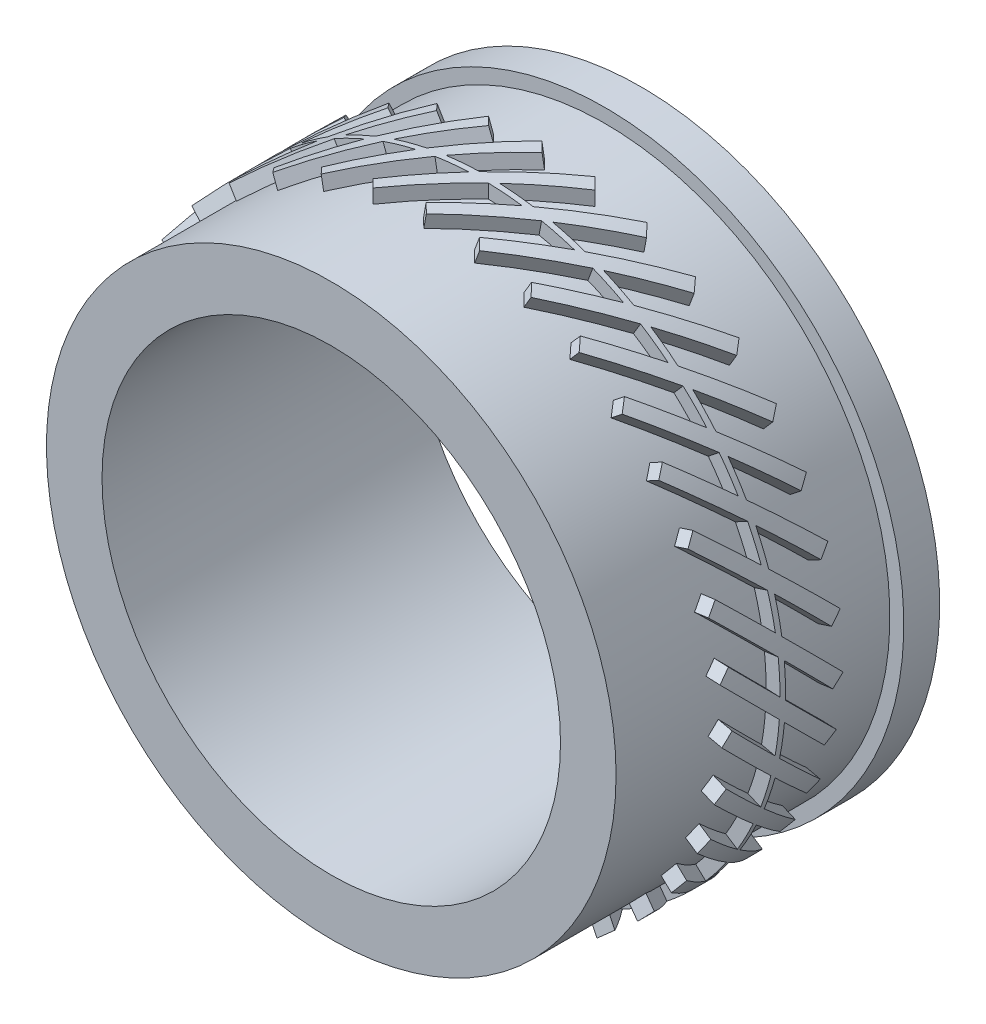
from build123d import *
from build123d.topology import SkipClean

# Parameters (mm, degrees)
SKETCH1_R                = 13.0175
SKETCH1_R_2              = 10.4775
BOSS_EXTRUDE1_DEPTH      = 6.985
SKETCH1_4_R              = 13.6525
SKETCH1_4_R_2            = 13.0175
BOSS_EXTRUDE2_DEPTH      = 0.127
BOSS_EXTRUDE3_REACH      = 22.532
BOSS_EXTRUDE3_END_RADIUS = 13.6525
CIRPATTERN1_COUNT        = 35
SKETCH1_5_R              = 10.4775
CUT_EXTRUDE2_DEPTH       = 6.985
SKETCH6_R                = 13.6525
SKETCH6_R_2              = 10.4775
BOSS_EXTRUDE6_DEPTH      = 0.82042
CUT_EXTRUDE3_DEPTH       = 21.596029605


with BuildPart() as part:
    # Sketch1 → Boss-Extrude1 (new, symmetric)
    with BuildSketch(Plane.XY):
        Circle(SKETCH1_R)
        Circle(SKETCH1_R_2, mode=Mode.SUBTRACT)
    extrude(amount=BOSS_EXTRUDE1_DEPTH, both=True)

    # Sketch1<4> → Boss-Extrude2 (add, symmetric)
    with BuildSketch(Plane.XY):
        Circle(SKETCH1_4_R)
        Circle(SKETCH1_4_R_2, mode=Mode.SUBTRACT)
    extrude(amount=BOSS_EXTRUDE2_DEPTH, both=True)

    # Boss-Extrude3: up to this cylinder (the profile starts inside it)
    with SkipClean():  # the faces are left unmerged after this step: merging them gives an invalid solid
        boss_extrude3_end = Plane(origin=(0, 0, 0), z_dir=(0, 0, -1)) * Cylinder(BOSS_EXTRUDE3_END_RADIUS, 73.369, mode=Mode.PRIVATE)
        # Sketch4 → Boss-Extrude3 (add, up to the surface)
        with BuildSketch(Plane(origin=(0, 0, 0), x_dir=(1, 0, 0), z_dir=(0, 1, 0)), mode=Mode.PRIVATE) as boss_extrude3_sk1:
            Polygon((2.764506403, 2.315493597), (-2.315493597, -2.764506403), (-2.764506403, -2.315493597), (2.315493597, 2.764506403), align=None)
        boss_extrude3_tool1 = extrude(boss_extrude3_sk1.sketch, amount=BOSS_EXTRUDE3_REACH, mode=Mode.PRIVATE) & boss_extrude3_end
        boss_extrude3 = boss_extrude3_tool1.solids().sort_by_distance((0, 0, 0))[0]
        add(boss_extrude3)

    # CirPattern1: Boss-Extrude3 ×35 about axis
    with SkipClean():  # the faces are left unmerged after this step: merging them gives an invalid solid
        cirpattern1_axis = Axis((0, 0, 0), (0, 0, 1))
        for i in range(1, CIRPATTERN1_COUNT):
            add(boss_extrude3.rotate(cirpattern1_axis, i * 360 / CIRPATTERN1_COUNT))

    # Sketch1<5> → Cut-Extrude2 (cut, symmetric)
    with SkipClean():  # the faces are left unmerged after this step: merging them gives an invalid solid
        with BuildSketch(Plane.XY):
            Circle(SKETCH1_5_R)
        extrude(amount=CUT_EXTRUDE2_DEPTH, both=True, mode=Mode.SUBTRACT)

    # Sketch6 → Boss-Extrude6 (add, symmetric)
    with BuildSketch(Plane(origin=(0, 0, -6.35), x_dir=(-1, 0, 0), z_dir=(0, 0, -1))):
        Circle(SKETCH6_R)
        Circle(SKETCH6_R_2, mode=Mode.SUBTRACT)
    extrude(amount=BOSS_EXTRUDE6_DEPTH, both=True)

    # Sketch4<19> → Cut-Extrude3 (cut, through all)
    # profile 1 of 10: a face of its own
    with BuildSketch(Plane(origin=(0, 0, 0), x_dir=(1, 0, 0), z_dir=(0, 1, 0))):
        with BuildLine():
            ThreePointArc((1.566348758, 5.867669953), (1.307747925, 5.746622786), (1.031626766, 5.819313315))
            ThreePointArc((1.031626766, 5.819313315), (0.842237613, 6.319789927), (0.428531892, 6.659190378))
            Line((0.428531892, 6.659190378), (0.60167716, 6.832335646))
            ThreePointArc((0.60167716, 6.832335646), (0.860412343, 6.953395929), (1.136621561, 6.880540213))
            ThreePointArc((1.136621561, 6.880540213), (1.325905989, 6.380164404), (1.739426226, 6.040744959))
            Line((1.739426226, 6.040744959), (1.566348758, 5.867669953))
        make_face()
        with BuildLine():
            ThreePointArc((1.018821456, 6.801939772), (0.84586666, 6.823392576), (0.691479721, 6.742533085))
            Line((0.691479721, 6.742533085), (0.637630649, 6.688684012))
            ThreePointArc((0.637630649, 6.688684012), (0.977082629, 6.347410418), (1.14941525, 5.897969899))
            ThreePointArc((1.14941525, 5.897969899), (1.322271948, 5.876634887), (1.476543603, 5.957473474))
            Line((1.476543603, 5.957473474), (1.530363313, 6.01129321))
            ThreePointArc((1.530363313, 6.01129321), (1.191058115, 6.352570503), (1.018821456, 6.801939772))
        make_face(mode=Mode.SUBTRACT)
    # profile 2 of 10: a face of its own
    with BuildSketch(Plane(origin=(0, 0, 0), x_dir=(1, 0, 0), z_dir=(0, 1, 0))):
        with BuildLine():
            ThreePointArc((-0.659529785, 6.880619266), (-0.470152803, 6.380219564), (-0.056521805, 6.040848232))
            Line((-0.056521805, 6.040848232), (-0.229702104, 5.867669721))
            ThreePointArc((-0.229702104, 5.867669721), (-0.488305497, 5.746622514), (-0.764428217, 5.81931629))
            ThreePointArc((-0.764428217, 5.81931629), (-0.953816926, 6.319791567), (-1.367522133, 6.65919043))
            Line((-1.367522133, 6.65919043), (-1.19436846, 6.832343781))
            ThreePointArc((-1.19436846, 6.832343781), (-0.935696894, 6.953397105), (-0.659529785, 6.880619266))
        make_face()
        with BuildLine():
            ThreePointArc((-0.777441459, 6.802044546), (-0.950296312, 6.823378291), (-1.104566306, 6.742540813))
            Line((-1.104566306, 6.742540813), (-1.158414584, 6.688692635))
            ThreePointArc((-1.158414584, 6.688692635), (-0.818961848, 6.347414916), (-0.646631592, 5.897969788))
            ThreePointArc((-0.646631592, 5.897969788), (-0.473775742, 5.876634801), (-0.319504532, 5.957472416))
            Line((-0.319504532, 5.957472416), (-0.265654159, 6.011322232))
            ThreePointArc((-0.265654159, 6.011322232), (-0.605109158, 6.352599121), (-0.777441459, 6.802044546))
        make_face(mode=Mode.SUBTRACT)
    # profile 3 of 10: a face of its own
    with BuildSketch(Plane(origin=(0, 0, 0), x_dir=(1, 0, 0), z_dir=(0, 1, 0))):
        with BuildLine():
            Line((2.168253354, 6.858), (2.168253354, 6.984800972))
            Line((2.168253354, 6.984800972), (1.335231675, 6.984800972))
            ThreePointArc((1.335231675, 6.984800972), (1.344565242, 6.96058185), (1.348780062, 6.934970981))
            ThreePointArc((1.348780062, 6.934970981), (1.352041065, 6.896387153), (1.357117719, 6.858))
            Line((1.357117719, 6.858), (2.168253354, 6.858))
        make_face()
    # profile 4 of 10: a face of its own
    with BuildSketch(Plane(origin=(0, 0, 0), x_dir=(1, 0, 0), z_dir=(0, 1, 0))):
        Polygon((1.719012553, 5.715005039), (2.168253354, 5.715005039), (2.168253354, 5.842004699), (1.846014018, 5.842004699), align=None)
    # profile 5 of 10: a face of its own
    with BuildSketch(Plane(origin=(0, 0, 0), x_dir=(1, 0, 0), z_dir=(0, 1, 0))):
        Polygon((-1.796048961, 6.984998329), (-1.796048961, 6.858001223), (-1.474039962, 6.858001223), (-1.347032123, 6.985008827), align=None)
    # profile 6 of 10: a face of its own
    with BuildSketch(Plane(origin=(0, 0, 0), x_dir=(1, 0, 0), z_dir=(0, 1, 0))):
        with BuildLine():
            Line((-0.984950522, 5.84200524), (-1.796048961, 5.84200524))
            Line((-1.796048961, 5.84200524), (-1.796049299, 5.715004259))
            Line((-1.796049299, 5.715004259), (-0.963024847, 5.715004259))
            ThreePointArc((-0.963024847, 5.715004259), (-0.972364886, 5.73923109), (-0.976582544, 5.76485114))
            ThreePointArc((-0.976582544, 5.76485114), (-0.979854361, 5.803527122), (-0.984950522, 5.84200524))
        make_face()
    # profile 7 of 10: a face of its own
    with BuildSketch(Plane(origin=(0, 0, 0), x_dir=(1, 0, 0), z_dir=(0, 1, 0))):
        with BuildLine():
            Line((0.78408235, 7.031043689), (0.449012806, 6.985))
            Line((0.449012806, 6.985), (0, 6.535987194))
            ThreePointArc((0, 6.535987194), (0.562628379, 6.312887348), (0.819472926, 5.764840714))
            ThreePointArc((0.819472926, 5.764840714), (0.823685671, 5.739226374), (0.833021198, 5.715004699))
            Line((0.833021198, 5.715004699), (1.120199853, 5.678607514))
            ThreePointArc((1.120199853, 5.678607514), (1.028604553, 5.717036802), (0.946238388, 5.772555482))
            ThreePointArc((0.946238388, 5.772555482), (0.741581547, 6.305539185), (0.267949024, 6.624331095))
            Line((0.267949024, 6.624331095), (0.538815367, 6.895197439))
            ThreePointArc((0.538815367, 6.895197439), (0.651891276, 6.980376538), (0.78408235, 7.031043689))
        make_face()
    # profile 8 of 10: a face of its own
    with BuildSketch(Plane(origin=(0, 0, 0), x_dir=(1, 0, 0), z_dir=(0, 1, 0))):
        with BuildLine():
            Line((-1.474039962, 6.858001223), (-1.796056114, 6.535985668))
            ThreePointArc((-1.796056114, 6.535985668), (-1.262317389, 6.338815707), (-0.984950522, 5.84200524))
            ThreePointArc((-0.984950522, 5.84200524), (-0.979854361, 5.803527122), (-0.976582544, 5.76485114))
            ThreePointArc((-0.976582544, 5.76485114), (-0.972364886, 5.73923109), (-0.963024847, 5.715004259))
            Line((-0.963024847, 5.715004259), (-0.675845492, 5.678606986))
            ThreePointArc((-0.675845492, 5.678606986), (-0.767442233, 5.717036633), (-0.849809584, 5.772556183))
            ThreePointArc((-0.849809584, 5.772556183), (-1.054462581, 6.305544428), (-1.528095606, 6.624340723))
            Line((-1.528095606, 6.624340723), (-1.257229968, 6.895205859))
            ThreePointArc((-1.257229968, 6.895205859), (-1.144101589, 6.980413289), (-1.011846327, 7.031077692))
            Line((-1.011846327, 7.031077692), (-1.347032123, 6.985008827))
            Line((-1.347032123, 6.985008827), (-1.474039962, 6.858001223))
        make_face()
    # profile 9 of 10: a face of its own
    with BuildSketch(Plane(origin=(0, 0, 0), x_dir=(1, 0, 0), z_dir=(0, 1, 0))):
        with BuildLine():
            ThreePointArc((1.348780062, 6.934970981), (1.344565242, 6.96058185), (1.335231675, 6.984800972))
            Line((1.335231675, 6.984800972), (1.04809069, 7.021316435))
            ThreePointArc((1.04809069, 7.021316435), (1.13967259, 6.982832512), (1.222014013, 6.927261415))
            ThreePointArc((1.222014013, 6.927261415), (1.426560972, 6.394407052), (1.899972852, 6.075574146))
            Line((1.899972852, 6.075574146), (1.629207994, 5.804809157))
            ThreePointArc((1.629207994, 5.804809157), (1.516078954, 5.719600596), (1.383822622, 5.668935606))
            Line((1.383822622, 5.668935606), (1.719012553, 5.715005039))
            Line((1.719012553, 5.715005039), (1.846014018, 5.842004699))
            Line((1.846014018, 5.842004699), (2.167828068, 6.163814174))
            ThreePointArc((2.167828068, 6.163814174), (1.634276508, 6.361191934), (1.357117719, 6.858))
            ThreePointArc((1.357117719, 6.858), (1.352041065, 6.896387153), (1.348780062, 6.934970981))
        make_face()
    # profile 10 of 10: a face of its own
    with BuildSketch(Plane(origin=(0, 0, 0), x_dir=(1, 0, 0), z_dir=(0, 1, 0))):
        with BuildLine():
            Line((-0.460976983, 6.985), (-0.748223557, 7.021405793))
            ThreePointArc((-0.748223557, 7.021405793), (-0.656629301, 6.982977072), (-0.574263918, 6.927459343))
            ThreePointArc((-0.574263918, 6.927459343), (-0.369607761, 6.394469532), (0.104029617, 6.075675059))
            Line((0.104029617, 6.075675059), (-0.166840966, 5.804807273))
            ThreePointArc((-0.166840966, 5.804807273), (-0.279968469, 5.719600424), (-0.412222621, 5.668936053))
            Line((-0.412222621, 5.668936053), (-0.077038418, 5.715004699))
            Line((-0.077038418, 5.715004699), (0.371976706, 6.164015186))
            ThreePointArc((0.371976706, 6.164015186), (-0.190545913, 6.387122042), (-0.447377368, 6.935069093))
            ThreePointArc((-0.447377368, 6.935069093), (-0.451606997, 6.960734583), (-0.460976983, 6.985))
        make_face()
    extrude(amount=-CUT_EXTRUDE3_DEPTH, mode=Mode.SUBTRACT)


with BuildPart() as cut_extrude3_piece_1:
    # of the separate pieces the step leaves, piece 1, a body of its own (cut_extrude3_pieces)
    add(part.part.solids().sort_by_distance((10.4775, 0, -5.52958))[0])


with BuildPart() as cut_extrude3_piece_2:
    # of the separate pieces the step leaves, piece 2, a body of its own (cut_extrude3_pieces)
    add(part.part.solids().sort_by_distance((1.476543603, -10.372937156, -5.957473474))[0])


with BuildPart() as cut_extrude3_piece_3:
    # of the separate pieces the step leaves, piece 3, a body of its own (cut_extrude3_pieces)
    add(part.part.solids().sort_by_distance((-0.319504532, -10.472627326, -5.957472416))[0])


solid = Compound([cut_extrude3_piece_1.part, cut_extrude3_piece_2.part, cut_extrude3_piece_3.part])
